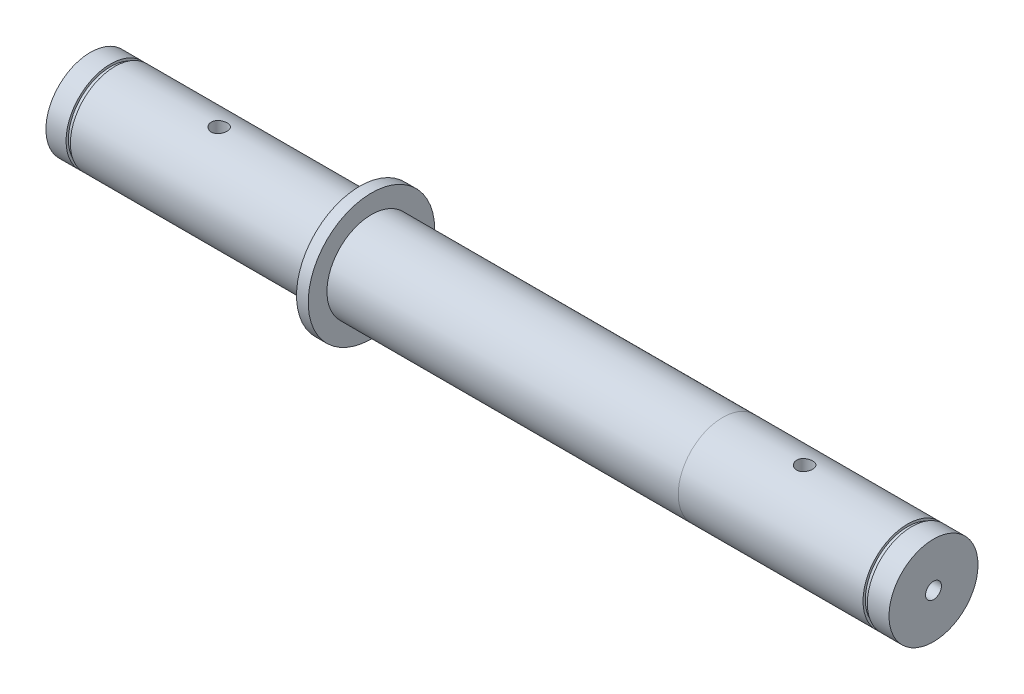
from build123d import *

# Parameters (mm, degrees)
M8_GEWINDEBOHRUNG1_D          = 6.8
M8_GEWINDEBOHRUNG1_DEPTH      = 325
M8_GEWINDEBOHRUNG1_TIP        = 2.042926105
SKIZZE18_W                    = 3.4
SKIZZE18_H                    = 27
M8_GEWINDEBOHRUNG3_AT_2_COUNT = 2
M8_GEWINDEBOHRUNG3_AT_2_PITCH = 250
SPIEGELN2_COPY_1_SKETCH_W     = 3.4
SPIEGELN2_COPY_1_SKETCH_H     = 27
SKIZZE19_W                    = 1.85
SKIZZE19_H                    = 1
SKIZZE20_W                    = 1.85
SKIZZE20_H                    = 1


with BuildPart() as part:
    # Skizze1 → Rotation1 (revolve)
    with BuildSketch(Plane.XY):
        Polygon((180, 19), (180, 0), (-180, 0), (-180, 19), (-65, 19), (-65, 27), (-60, 27), (-60, 19.0001), (90, 19.0001), align=None)
    revolve(axis=Axis((180, 0, 0), (-1, 0, 0)))

    # M8 Gewindebohrung1
    with Locations(Plane(origin=(180, 0, 0), x_dir=(0, 0, -1), z_dir=(1, 0, 0))):
        with Locations((0, 0)):
            Hole(M8_GEWINDEBOHRUNG1_D / 2, depth=M8_GEWINDEBOHRUNG1_DEPTH)
            with Locations((0, 0, -(M8_GEWINDEBOHRUNG1_DEPTH + M8_GEWINDEBOHRUNG1_TIP / 2))):  # 118° drill point
                Cone(0, M8_GEWINDEBOHRUNG1_D / 2, M8_GEWINDEBOHRUNG1_TIP, mode=Mode.SUBTRACT)

    # Skizze18 → M8 Gewindebohrung3 (revolve, cut)
    with BuildSketch(Plane(origin=(-125, 0, 0), x_dir=(0, 0, -1), z_dir=(1, 0, 0))):
        with Locations((1.7, 13.5)):
            Rectangle(SKIZZE18_W, SKIZZE18_H)
    m8_gewindebohrung3 = revolve(axis=Axis((-125, -6.35, 0), (0, 1, 0)), mode=Mode.SUBTRACT)

    # M8 Gewindebohrung3 at 2: M8 Gewindebohrung3 ×2
    with Locations(*[(i * M8_GEWINDEBOHRUNG3_AT_2_PITCH, 0, 0) for i in range(1, M8_GEWINDEBOHRUNG3_AT_2_COUNT)]):
        add(m8_gewindebohrung3, mode=Mode.SUBTRACT)

    # Spiegeln2: M8 Gewindebohrung3 across plane
    add(m8_gewindebohrung3.mirror(Plane.ZX), mode=Mode.SUBTRACT)

    # Spiegeln2 copy 1 sketch → Spiegeln2 copy 1 (revolve, cut)
    with BuildSketch(Plane(origin=(125, 0, 0), x_dir=(0, 0, -1), z_dir=(1, 0, 0))):
        with Locations((1.7, -13.5)):
            Rectangle(SPIEGELN2_COPY_1_SKETCH_W, SPIEGELN2_COPY_1_SKETCH_H)
    revolve(axis=Axis((125, 6.35, 0), (0, 1, 0)), mode=Mode.SUBTRACT)

    # Skizze19 → Schnitt-Rotation1 (revolve, cut)
    with BuildSketch(Plane.XY):
        with Locations((169.825, 18.5)):
            Rectangle(SKIZZE19_W, SKIZZE19_H)
    revolve(axis=Axis((-88.99, 0, 0), (1, 0, 0)), mode=Mode.SUBTRACT)

    # Skizze20 → Schnitt-Rotation2 (revolve, cut)
    with BuildSketch(Plane.XY):
        with Locations((-170.475, 18.5)):
            Rectangle(SKIZZE20_W, SKIZZE20_H)
    revolve(axis=Axis((-88.99, 0, 0), (1, 0, 0)), mode=Mode.SUBTRACT)


solid = part.part
